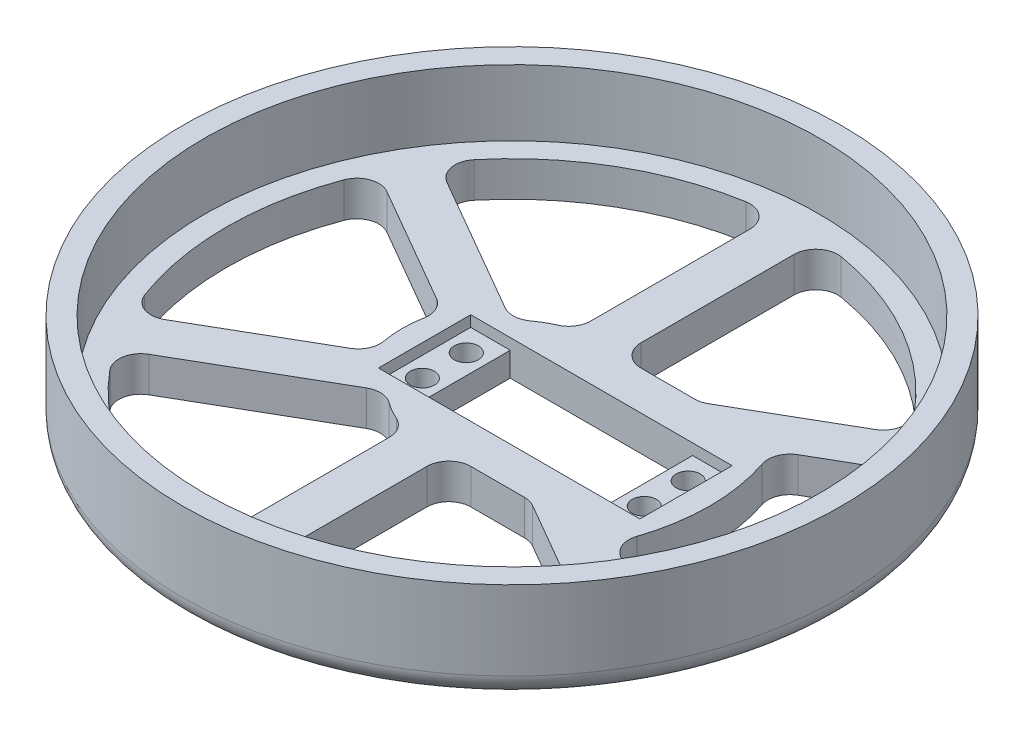
from build123d import *

# Parameters (mm, degrees)
SKETCH1_R                = 75
BOSS_EXTRUDE1_DEPTH      = 8
SKETCH5_R                = 75
SKETCH5_R_2              = 70
BOSS_EXTRUDE2_DEPTH      = 15
CUT_EXTRUDE6_DEPTH       = 108.121426428
CUT_EXTRUDE6_DEPTH_BACK  = 108.121426428
SKETCH2_W                = 41.5
SKETCH2_H                = 21
SKETCH8_W                = 9
SKETCH8_H                = 21
SKETCH8_R                = 2.75
CUT_EXTRUDE7_DEPTH       = 2.5
CUT_EXTRUDE8_DEPTH       = 108.121426428
CUT_EXTRUDE8_DEPTH_BACK  = 108.121426428
SKETCH9_R                = 2.75
CUT_EXTRUDE11_DEPTH      = 109.531101533
CUT_EXTRUDE11_DEPTH_BACK = 109.531101533
FILLET1_R                = 5
FILLET2_R                = 5


with BuildPart() as part:
    # Sketch1 → Boss-Extrude1 (new body)
    with BuildSketch(Plane(origin=(0, 0, 0), x_dir=(1, 0, 0), z_dir=(0, 1, 0))):
        Circle(SKETCH1_R)
    extrude(amount=BOSS_EXTRUDE1_DEPTH)

    # Sketch5 → Boss-Extrude2 (add)
    with BuildSketch(Plane(origin=(0, 8, 0), x_dir=(1, 0, 0), z_dir=(0, 1, 0))):
        Circle(SKETCH5_R)
        Circle(SKETCH5_R_2, mode=Mode.SUBTRACT)
    extrude(amount=BOSS_EXTRUDE2_DEPTH)

    # Sketch2 → Cut-Extrude6 (cut, two sides: drawn at the far end of the back side and taken through both)
    with BuildSketch(Plane(origin=(0, 8, 0), x_dir=(1, 0, 0), z_dir=(0, 1, 0)).offset(-CUT_EXTRUDE6_DEPTH_BACK)):
        with Locations((9.85, 0)):
            Rectangle(SKETCH2_W, SKETCH2_H)
    extrude(amount=CUT_EXTRUDE6_DEPTH + CUT_EXTRUDE6_DEPTH_BACK, mode=Mode.SUBTRACT)

    # Sketch8 → Cut-Extrude7 (cut)
    # profile 1 of 2: a face of its own
    with BuildSketch(Plane(origin=(0, 8, 0), x_dir=(1, 0, 0), z_dir=(0, 1, 0))):
        with Locations((-15.4, 0)):
            Rectangle(SKETCH8_W, SKETCH8_H)
        with Locations((-15.4, 5)):
            Circle(SKETCH8_R, mode=Mode.SUBTRACT)
        with Locations((-15.4, -5)):
            Circle(SKETCH8_R, mode=Mode.SUBTRACT)
    # profile 2 of 2: a face of its own
    with BuildSketch(Plane(origin=(0, 8, 0), x_dir=(1, 0, 0), z_dir=(0, 1, 0))):
        with Locations((35.1, 0)):
            Rectangle(SKETCH8_W, SKETCH8_H)
        with Locations((35.1, -5)):
            Circle(SKETCH8_R, mode=Mode.SUBTRACT)
        with Locations((35.1, 5)):
            Circle(SKETCH8_R, mode=Mode.SUBTRACT)
    extrude(amount=-CUT_EXTRUDE7_DEPTH, mode=Mode.SUBTRACT)

    # Sketch9 → Cut-Extrude8 (cut, two sides: drawn at the far end of the back side and taken through both)
    with BuildSketch(Plane(origin=(0, 8, 0), x_dir=(1, 0, 0), z_dir=(0, 1, 0)).offset(-CUT_EXTRUDE8_DEPTH_BACK)):
        with Locations((-15.4, 5)):
            Circle(SKETCH9_R)
        with Locations((-15.4, -5)):
            Circle(SKETCH9_R)
        with Locations((35.1, 5)):
            Circle(SKETCH9_R)
        with Locations((35.1, -5)):
            Circle(SKETCH9_R)
    extrude(amount=CUT_EXTRUDE8_DEPTH + CUT_EXTRUDE8_DEPTH_BACK, mode=Mode.SUBTRACT)

    # Sketch6 → Cut-Extrude11 (cut, two sides: drawn at the far end of the back side and taken through both)
    with BuildSketch(Plane.XZ.offset(-CUT_EXTRUDE11_DEPTH_BACK)):
        with BuildLine():
            Line((23.541019662, -19.364916731), (5, -19.364916731))
            Line((5, -19.364916731), (5, -64.807406984))
            ThreePointArc((5, -64.807406984), (32.5, -56.291651246), (53.624860802, -36.733830511))
            Line((53.624860802, -36.733830511), (23.541019662, -19.364916731))
        make_face()
        with BuildLine():
            Line((5, 64.807406984), (5, 19.364916731))
            Line((5, 19.364916731), (23.541019662, 19.364916731))
            Line((23.541019662, 19.364916731), (53.624860802, 36.733830511))
            ThreePointArc((53.624860802, 36.733830511), (32.5, 56.291651246), (5, 64.807406984))
        make_face()
        with BuildLine():
            ThreePointArc((-53.624860802, -36.733830511), (-32.5, -56.291651246), (-5, -64.807406984))
            Line((-5, -64.807406984), (-5, -19.364916731))
            ThreePointArc((-5, -19.364916731), (-10, -17.320508076), (-14.270509831, -14.012585384))
            Line((-14.270509831, -14.012585384), (-53.624860802, -36.733830511))
        make_face()
        with BuildLine():
            ThreePointArc((-58.624860802, 28.073576473), (-65, 0), (-58.624860802, -28.073576473))
            Line((-58.624860802, -28.073576473), (-23.713203436, -7.917321695))
            ThreePointArc((-23.713203436, -7.917321695), (-25, 0), (-23.713203436, 7.917321695))
            Line((-23.713203436, 7.917321695), (-58.624860802, 28.073576473))
        make_face()
        with BuildLine():
            ThreePointArc((-5, 64.807406984), (-32.5, 56.291651246), (-53.624860802, 36.733830511))
            Line((-53.624860802, 36.733830511), (-14.270509831, 14.012585384))
            ThreePointArc((-14.270509831, 14.012585384), (-10, 17.320508076), (-5, 19.364916731))
            Line((-5, 19.364916731), (-5, 64.807406984))
        make_face()
        with BuildLine():
            ThreePointArc((58.624860802, -28.073576473), (65, 0), (58.624860802, 28.073576473))
            Line((58.624860802, 28.073576473), (41.229833462, 18.030552756))
            ThreePointArc((41.229833462, 18.030552756), (45, 0), (41.229833462, -18.030552756))
            Line((41.229833462, -18.030552756), (58.624860802, -28.073576473))
        make_face()
    extrude(amount=CUT_EXTRUDE11_DEPTH + CUT_EXTRUDE11_DEPTH_BACK, mode=Mode.SUBTRACT)

    # Fillet1
    fillet1_edges = [part.edges().sort_by_distance(p)[0] for p in [
        (53.624860802, 4, 36.733830511),
        (5, 4, 64.807406984),
        (-53.624860802, 4, 36.733830511),
        (-5, 4, 64.807406984),
        (-58.624860802, 4, 28.073576473),
        (-58.624860802, 4, -28.073576473),
        (-53.624860802, 4, -36.733830511),
        (-5, 4, -64.807406984),
        (5, 4, -64.807406984),
        (53.624860802, 4, -36.733830511),
        (58.624860802, 4, -28.073576473),
        (58.624860802, 4, 28.073576473),
        (41.229833462, 4, 18.030552756),
        (41.229833462, 4, -18.030552756),
        (5, 4, -19.364916731),
        (23.541019662, 4, -19.364916731),
        (-14.270509831, 4, -14.012585384),
        (-5, 4, -19.364916731),
        (-23.713203436, 4, 7.917321695),
        (-23.713203436, 4, -7.917321695),
        (-5, 4, 19.364916731),
        (-14.270509831, 4, 14.012585384),
        (5, 4, 19.364916731),
        (23.541019662, 4, 19.364916731),
    ]]
    fillet(fillet1_edges, radius=FILLET1_R)

    # Fillet2
    fillet2_edges = [part.edges().sort_by_distance(p)[0] for p in [
        (-75, 0, 0),
    ]]
    fillet(fillet2_edges, radius=FILLET2_R)


solid = part.part
